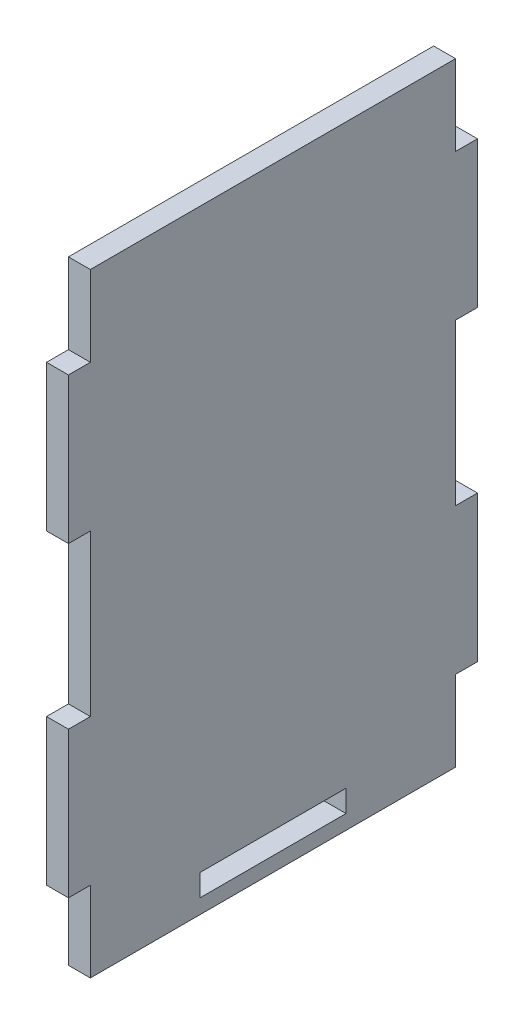
from build123d import *

# Parameters (mm, degrees)
SKETCH1_W           = 20
SKETCH1_H           = 3
BOSS_EXTRUDE2_DEPTH = 3


with BuildPart() as part:
    # Sketch1 → Boss-Extrude2 (new body)
    with BuildSketch(Plane(origin=(0, 0, 0), x_dir=(0, 0, -1), z_dir=(1, 0, 0))):
        Polygon((0, 0), (50, 0), (50, 11), (53, 11), (53, 31), (50, 31), (50, 53), (53, 53), (53, 73), (50, 73), (50, 84), (0, 84), (0, 73), (-3, 73), (-3, 53), (0, 53), (0, 31), (-3, 31), (-3, 11), (0, 11), align=None)
        with Locations((25, 3.5)):
            Rectangle(SKETCH1_W, SKETCH1_H, mode=Mode.SUBTRACT)
    extrude(amount=BOSS_EXTRUDE2_DEPTH)


solid = part.part
